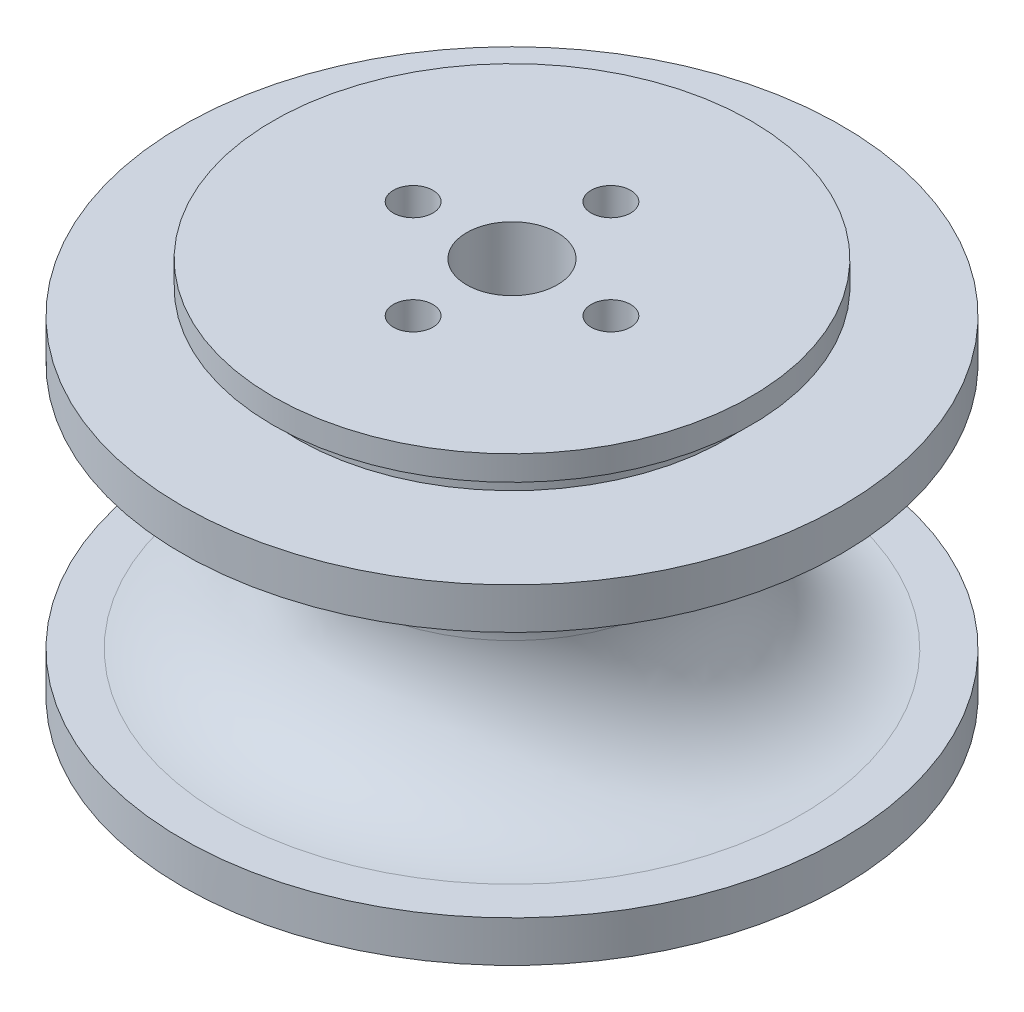
from build123d import *

# Parameters (mm, degrees)
SKETCH_1_R          = 40
EXTRUDE_1_DEPTH     = 40
SKETCH_2_R          = 26
EXTRUDE_2_DEPTH     = 3
SKETCH_3_R          = 29
EXTRUDE_3_DEPTH     = 3
FILLET_1_R          = 1
EXTRUDE_START       = 3
SKETCH_4_R          = 26
EXTRUDE_4_DEPTH     = 3
SKETCH_5_R          = 28
EXTRUDE_5_DEPTH     = 3
FILLET_2_R          = 1
SKETCH_6_W          = 20
SKETCH_6_H          = 30
FILLET_5_R          = 15
SKETCH_7_R          = 5.5
CUT_EXTRUDE_1_DEPTH = 77.837490849
SKETCH_8_R          = 2.4
CUT_EXTRUDE_2_DEPTH = 77.837490849


with BuildPart() as part:
    # 草图1 → 凸台-拉伸1 (new body)
    with BuildSketch(Plane(origin=(0, 0, 0), x_dir=(1, 0, 0), z_dir=(0, 1, 0))):
        with Locations(Location((0, 0, 0), (0, 0, 270))):
            Circle(SKETCH_1_R)
    extrude(amount=EXTRUDE_1_DEPTH)

    # 草图2 → 凸台-拉伸2 (add)
    with BuildSketch(Plane(origin=(0, 40, 0), x_dir=(1, 0, 0), z_dir=(0, 1, 0))):
        with Locations(Location((0, 0, 0), (0, 0, 270))):
            Circle(SKETCH_2_R)
    extrude(amount=EXTRUDE_2_DEPTH)

    # 草图3 → 凸台-拉伸3 (add)
    with BuildSketch(Plane(origin=(0, 43, 0), x_dir=(1, 0, 0), z_dir=(0, 1, 0))):
        with Locations(Location((0, 0, 0), (0, 0, 270))):
            Circle(SKETCH_3_R)
    extrude(amount=EXTRUDE_3_DEPTH)

    # 圆角1
    fillet_1_edges = [part.edges().sort_by_distance(p)[0] for p in [
        (0, 43, -26),
    ]]
    fillet(fillet_1_edges, radius=FILLET_1_R)

    # 草图4 → 凸台-拉伸4 (add)
    with BuildSketch(Plane.XZ.offset(EXTRUDE_START)):
        with Locations(Location((0, 0, 0), (0, 0, 90))):
            Circle(SKETCH_4_R)
    extrude(amount=-EXTRUDE_4_DEPTH)

    # 草图5 → 凸台-拉伸5 (add)
    with BuildSketch(Plane.XZ.offset(3)):
        with Locations(Location((0, 0, 0), (0, 0, 270))):
            Circle(SKETCH_5_R)
    extrude(amount=EXTRUDE_5_DEPTH)

    # 圆角2
    fillet_2_edges = [part.edges().sort_by_distance(p)[0] for p in [
        (0, -3, -26),
    ]]
    fillet(fillet_2_edges, radius=FILLET_2_R)

    # 草图6 → 切除-旋转1 (revolve, cut)
    with BuildSketch(Plane.XY, mode=Mode.PRIVATE) as cut_revolve_1_sk:
        with Locations((-30, 20)):
            Rectangle(SKETCH_6_W, SKETCH_6_H)
    revolve(cut_revolve_1_sk.sketch.rotate(Axis((0, -960, 0), (0, 1, 0)), 180), axis=Axis((0, -960, 0), (0, 1, 0)), mode=Mode.SUBTRACT)

    # 圆角5
    fillet_5_edges = [part.edges().sort_by_distance(p)[0] for p in [
        (-20, 5, 0),
        (-20, 35, 0),
    ]]
    fillet(fillet_5_edges, radius=FILLET_5_R - 0.0001)  # a hair under: the kernel refuses the full size

    # 草图7 → 切除-拉伸1 (cut, through all)
    with BuildSketch(Plane.XZ.offset(6)):
        with Locations(Location((0, 0, 0), (0, 0, 270))):
            Circle(SKETCH_7_R)
    extrude(amount=-CUT_EXTRUDE_1_DEPTH, mode=Mode.SUBTRACT)

    # 草图8 → 切除-拉伸2 (cut, through all)
    with BuildSketch(Plane.XZ.offset(6)):
        with Locations(Location((0, 12, 0), (0, 0, 270))):
            Circle(SKETCH_8_R)
        with Locations(Location((12, 0, 0), (0, 0, 270))):
            Circle(SKETCH_8_R)
        with Locations(Location((0, -12, 0), (0, 0, 270))):
            Circle(SKETCH_8_R)
        with Locations(Location((-12, 0, 0), (0, 0, 270))):
            Circle(SKETCH_8_R)
    extrude(amount=-CUT_EXTRUDE_2_DEPTH, mode=Mode.SUBTRACT)


solid = part.part
